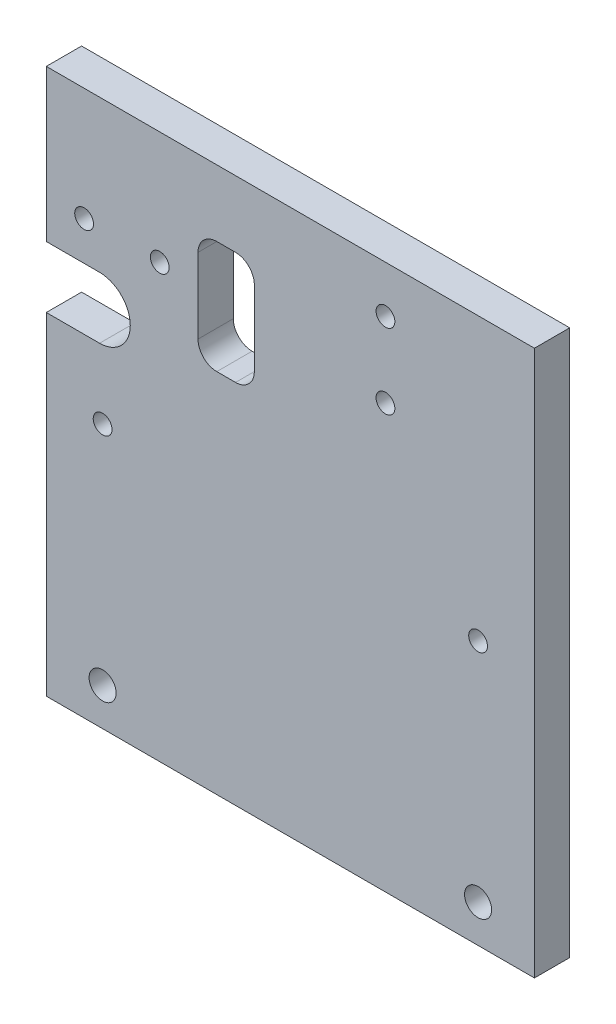
from build123d import *

# Parameters (mm, degrees)
SKETCH1_W           = 130
SKETCH1_H           = 145.26
SKETCH1_R           = 3.6
SKETCH1_R_2         = 2.5
BOSS_EXTRUDE1_DEPTH = 9.4
SKETCH2_R           = 2.5
CUT_EXTRUDE1_DEPTH  = 178.788153711
CUT_EXTRUDE2_DEPTH  = 178.788153711
CUT_EXTRUDE3_DEPTH  = 178.788153711
SKETCH5_R           = 2.5
CUT_EXTRUDE4_DEPTH  = 178.788153711


with BuildPart() as part:
    # Sketch1 → Boss-Extrude1 (new body)
    with BuildSketch(Plane.XY):
        with Locations((50, 62.63)):
            Rectangle(SKETCH1_W, SKETCH1_H)
        Circle(SKETCH1_R, mode=Mode.SUBTRACT)
        with Locations((0, 60.26)):
            Circle(SKETCH1_R_2, mode=Mode.SUBTRACT)
        with Locations((100, 60.26)):
            Circle(SKETCH1_R_2, mode=Mode.SUBTRACT)
        with Locations((100, 0)):
            Circle(SKETCH1_R, mode=Mode.SUBTRACT)
    extrude(amount=BOSS_EXTRUDE1_DEPTH)

    # Sketch2 → Cut-Extrude1 (cut, through all)
    with BuildSketch(Plane.XY.offset(9.4)):
        with Locations((75.33, 122.766411568)):
            Circle(SKETCH2_R)
        with Locations((75.33, 102.766411568)):
            Circle(SKETCH2_R)
    extrude(amount=-CUT_EXTRUDE1_DEPTH, mode=Mode.SUBTRACT)

    # Sketch3 → Cut-Extrude2 (cut, through all)
    with BuildSketch(Plane(origin=(0, 0, 0), x_dir=(-1, 0, 0), z_dir=(0, 0, -1))):
        with BuildLine():
            Line((-35.40754614, 117.570367495), (-30.40754614, 117.570367495))
            ThreePointArc((-30.40754614, 117.570367495), (-26.872012234, 116.105901401), (-25.40754614, 112.570367495))
            Line((-25.40754614, 112.570367495), (-25.40754614, 92.570367495))
            ThreePointArc((-25.40754614, 92.570367495), (-26.872012234, 89.034833589), (-30.40754614, 87.570367495))
            Line((-30.40754614, 87.570367495), (-35.40754614, 87.570367495))
            ThreePointArc((-35.40754614, 87.570367495), (-38.943080046, 89.034833589), (-40.40754614, 92.570367495))
            Line((-40.40754614, 92.570367495), (-40.40754614, 112.570367495))
            ThreePointArc((-40.40754614, 112.570367495), (-38.943080046, 116.105901401), (-35.40754614, 117.570367495))
        make_face()
    extrude(amount=-CUT_EXTRUDE2_DEPTH, mode=Mode.SUBTRACT)

    # Sketch4 → Cut-Extrude3 (cut, through all)
    with BuildSketch(Plane.XY.offset(9.4)):
        with BuildLine():
            Line((-15, 78.5), (-15, 94.86))
            Line((-15, 94.86), (-0.81, 94.86))
            ThreePointArc((-0.81, 94.86), (7.37, 86.68), (-0.81, 78.5))
            Line((-0.81, 78.5), (-15, 78.5))
        make_face()
    extrude(amount=-CUT_EXTRUDE3_DEPTH, mode=Mode.SUBTRACT)

    # Sketch5 → Cut-Extrude4 (cut, through all)
    with BuildSketch(Plane.XY.offset(9.4)):
        with Locations((-4.926856844, 105.186)):
            Circle(SKETCH5_R)
        with Locations((15.215343156, 105.186)):
            Circle(SKETCH5_R)
    extrude(amount=-CUT_EXTRUDE4_DEPTH, mode=Mode.SUBTRACT)


solid = part.part
